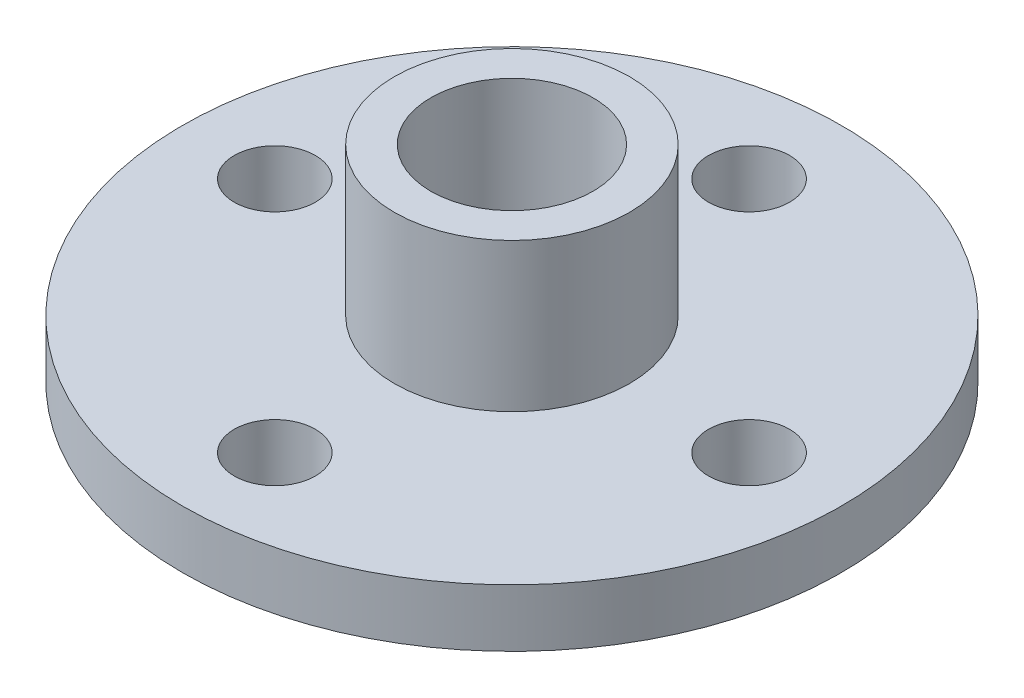
from build123d import *

# Parameters (mm, degrees)
SKETCH1_R           = 10.16
SKETCH1_R_2         = 1.625
BOSS_EXTRUDE2_DEPTH = 1.778
SKETCH3_R           = 3.625
SKETCH3_R_2         = 2.5
BOSS_EXTRUDE3_DEPTH = 4.572
SKETCH4_R           = 1.25
CUT_EXTRUDE1_DEPTH  = 16.709032434


with BuildPart() as part:
    # Sketch1 → Boss-Extrude2 (new body)
    with BuildSketch(Plane(origin=(0, 0, 0), x_dir=(1, 0, 0), z_dir=(0, 1, 0))):
        Circle(SKETCH1_R)
        Circle(SKETCH1_R_2, mode=Mode.SUBTRACT)
    extrude(amount=BOSS_EXTRUDE2_DEPTH)

    # Sketch3 → Boss-Extrude3 (add)
    with BuildSketch(Plane(origin=(0, 1.778, 0), x_dir=(1, 0, 0), z_dir=(0, 1, 0))):
        Circle(SKETCH3_R)
        Circle(SKETCH3_R_2, mode=Mode.SUBTRACT)
    extrude(amount=BOSS_EXTRUDE3_DEPTH)

    # Sketch4 → Cut-Extrude1 (cut, through all)
    with BuildSketch(Plane.XZ):
        with Locations((0, 7.31)):
            Circle(SKETCH4_R)
        with Locations((7.31, 0)):
            Circle(SKETCH4_R)
        with Locations((-7.31, 0)):
            Circle(SKETCH4_R)
        with Locations((0, -7.31)):
            Circle(SKETCH4_R)
    extrude(amount=-CUT_EXTRUDE1_DEPTH, mode=Mode.SUBTRACT)


solid = part.part
